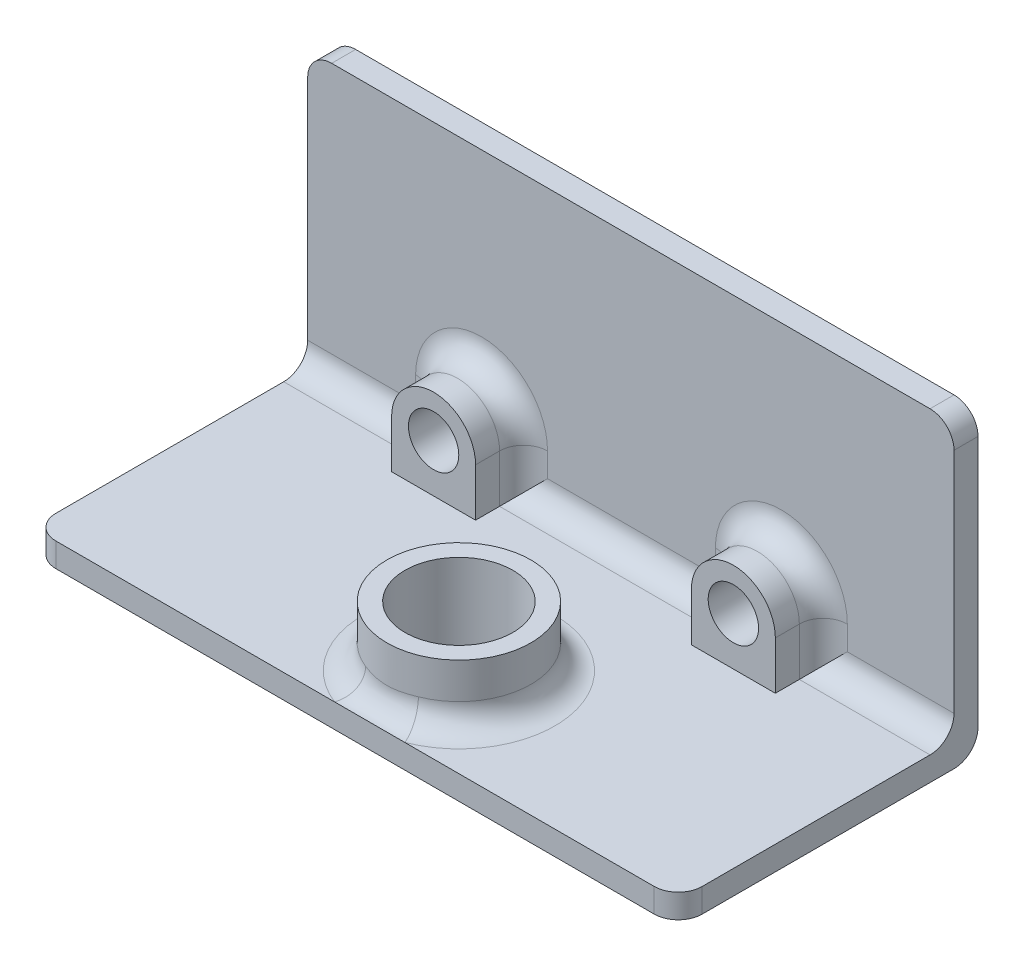
from build123d import *

# Parameters (mm, degrees)
SKETCH1_W           = 53.9
SKETCH1_H           = 25
BOSS_EXTRUDE1_DEPTH = 2
SKETCH2_W           = 53.9
SKETCH2_H           = 2
BOSS_EXTRUDE2_DEPTH = 23
SKETCH3_R           = 2.1
CUT_EXTRUDE1_DEPTH  = 64.711929809
SKETCH4_R           = 4.5
CUT_EXTRUDE2_DEPTH  = 64.711929809
BOSS_EXTRUDE3_START = 4
SKETCH5_R           = 2.1
BOSS_EXTRUDE3_DEPTH = 4
BOSS_EXTRUDE4_START = 5
SKETCH6_R           = 6
SKETCH6_R_2         = 4.5
BOSS_EXTRUDE4_DEPTH = 5
FILLET1_R           = 2


with BuildPart() as part:
    # Sketch1 → Boss-Extrude1 (new body)
    with BuildSketch(Plane.XY):
        with Locations((26.95, 12.5)):
            Rectangle(SKETCH1_W, SKETCH1_H)
    extrude(amount=BOSS_EXTRUDE1_DEPTH)

    # Sketch2 → Boss-Extrude2 (add)
    with BuildSketch(Plane.XY.offset(2)):
        with Locations((26.95, 1)):
            Rectangle(SKETCH2_W, SKETCH2_H)
    extrude(amount=BOSS_EXTRUDE2_DEPTH)

    # Sketch3 → Cut-Extrude1 (cut, through all)
    with BuildSketch(Plane.XY.offset(2)):
        with Locations((39.5, 6)):
            Circle(SKETCH3_R)
        with Locations((14.5, 6)):
            Circle(SKETCH3_R)
    extrude(amount=-CUT_EXTRUDE1_DEPTH, mode=Mode.SUBTRACT)

    # Sketch4 → Cut-Extrude2 (cut, through all)
    with BuildSketch(Plane(origin=(0, 2, 0), x_dir=(1, 0, 0), z_dir=(0, 1, 0))):
        with Locations((28.167949192, -17.557050808)):
            Circle(SKETCH4_R)
    extrude(amount=-CUT_EXTRUDE2_DEPTH, mode=Mode.SUBTRACT)

    # Sketch5 → Boss-Extrude3 (add)
    # profile 1 of 2: a face of its own
    with BuildSketch(Plane.XY.offset(2).offset(BOSS_EXTRUDE3_START)):
        with BuildLine():
            Line((18, 6), (18, 2))
            Line((18, 2), (11, 2))
            Line((11, 2), (11, 6))
            ThreePointArc((11, 6), (14.5, 9.5), (18, 6))
        make_face()
        with Locations((14.5, 6)):
            Circle(SKETCH5_R, mode=Mode.SUBTRACT)
    # profile 2 of 2: a face of its own
    with BuildSketch(Plane.XY.offset(2).offset(BOSS_EXTRUDE3_START)):
        with BuildLine():
            Line((36, 6), (36, 2))
            Line((36, 2), (43, 2))
            Line((43, 2), (43, 6))
            ThreePointArc((43, 6), (39.5, 9.5), (36, 6))
        make_face()
        with Locations((39.5, 6)):
            Circle(SKETCH5_R, mode=Mode.SUBTRACT)
    extrude(amount=-BOSS_EXTRUDE3_DEPTH)

    # Sketch6 → Boss-Extrude4 (add)
    with BuildSketch(Plane(origin=(0, 2, 0), x_dir=(1, 0, 0), z_dir=(0, 1, 0)).offset(BOSS_EXTRUDE4_START)):
        with Locations((28.167949192, -17.557050808)):
            Circle(SKETCH6_R)
        with Locations((28.167949192, -17.557050808)):
            Circle(SKETCH6_R_2, mode=Mode.SUBTRACT)
    extrude(amount=-BOSS_EXTRUDE4_DEPTH)

    # Fillet1
    fillet1_edges = [part.edges().sort_by_distance(p)[0] for p in [
        (43, 4, 2),
        (39.5, 9.5, 2),
        (18, 4, 2),
        (14.5, 9.5, 2),
        (26.95, 0, 0),
        (53.9, 1, 25),
        (0, 1, 25),
        (0, 25, 1),
        (53.9, 25, 1),
        (48.45, 2, 2),
        (5.5, 2, 2),
        (27, 2, 2),
        (36, 4, 2),
        (11, 4, 2),
        (22.167949192, 2, 17.557050808),
    ]]
    fillet(fillet1_edges, radius=FILLET1_R)


solid = part.part
